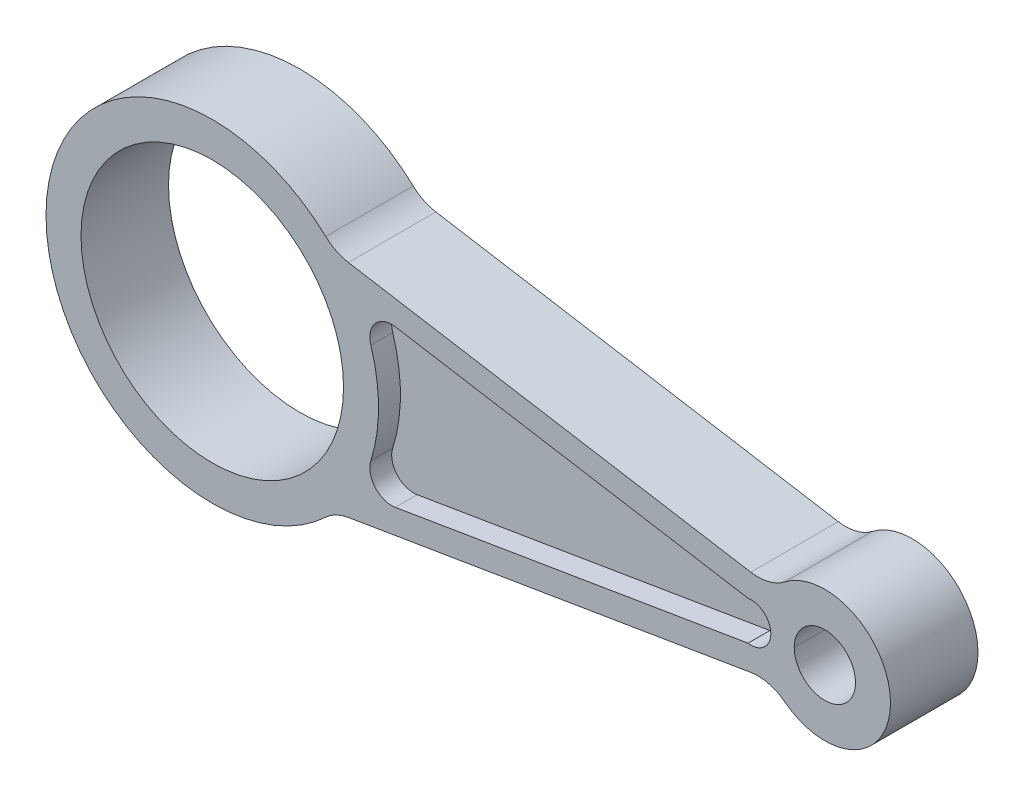
from build123d import *

# Parameters (mm, degrees)
SKETCH1_R           = 30
SKETCH1_R_2         = 7
BOSS_EXTRUDE1_DEPTH = 10
FILLET1_R           = 10
FILLET2_R           = 10
FILLET3_R           = 10
FILLET4_R           = 10
CUT_EXTRUDE1_DEPTH  = 5


with BuildPart() as part:
    # Sketch1 → Boss-Extrude1 (new, symmetric)
    with BuildSketch(Plane.XY):
        with BuildLine():
            Line((128.063755469, 9.084385863), (27.935473676, 25.760615491))
            ThreePointArc((27.935473676, 25.760615491), (-38, 0), (27.935473676, -25.760615491))
            Line((27.935473676, -25.760615491), (128.063755469, -9.084385863))
            ThreePointArc((128.063755469, -9.084385863), (155, 0), (128.063755469, 9.084385863))
        make_face()
        Circle(SKETCH1_R, mode=Mode.SUBTRACT)
        with Locations((140, 0)):
            Circle(SKETCH1_R_2, mode=Mode.SUBTRACT)
    extrude(amount=BOSS_EXTRUDE1_DEPTH, both=True)

    # Fillet1
    fillet1_edges = [part.edges().sort_by_distance(p)[0] for p in [
        (27.935473676, 25.760615491, 0),
    ]]
    fillet(fillet1_edges, radius=FILLET1_R)

    # Fillet2
    fillet2_edges = [part.edges().sort_by_distance(p)[0] for p in [
        (27.935473676, -25.760615491, 0),
    ]]
    fillet(fillet2_edges, radius=FILLET2_R)

    # Fillet3
    fillet3_edges = [part.edges().sort_by_distance(p)[0] for p in [
        (128.063755469, 9.084385863, 0),
    ]]
    fillet(fillet3_edges, radius=FILLET3_R)

    # Fillet4
    fillet4_edges = [part.edges().sort_by_distance(p)[0] for p in [
        (128.063755469, -9.084385863, 0),
    ]]
    fillet(fillet4_edges, radius=FILLET4_R)

    # Sketch2 → Cut-Extrude1 (cut)
    with BuildSketch(Plane.XY.offset(10)):
        with BuildLine():
            Line((41.828554558, 17.870982725), (122.444387692, 4.444524975))
            ThreePointArc((122.444387692, 4.444524975), (127.648800741, 0), (122.444387692, -4.444524975))
            Line((122.444387692, -4.444524975), (41.828554558, -17.870982725))
            ThreePointArc((41.828554558, -17.870982725), (37.231968851, -16.21736176), (36.238855565, -11.434393178))
            ThreePointArc((36.238855565, -11.434393178), (38, 6.9e-08), (36.238855523, 11.43439331))
            ThreePointArc((36.238855523, 11.43439331), (37.231968897, 16.217361812), (41.828554558, 17.870982725))
        make_face()
    cut_extrude1 = extrude(amount=-CUT_EXTRUDE1_DEPTH, mode=Mode.SUBTRACT)

    # Mirror1: Cut-Extrude1 across plane
    add(cut_extrude1.mirror(Plane.XY), mode=Mode.SUBTRACT)


solid = part.part
